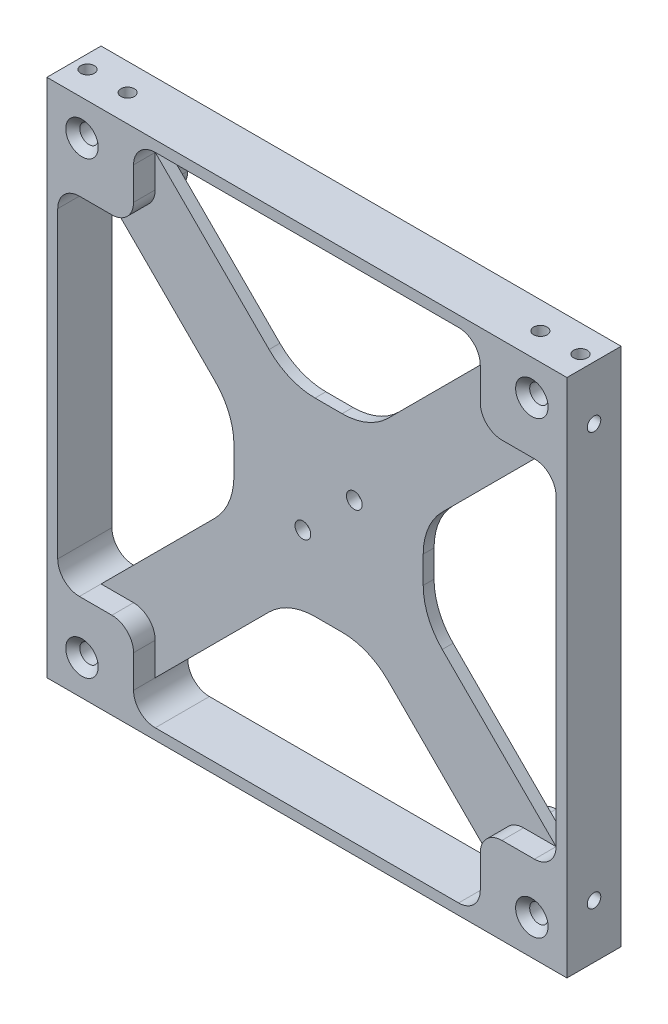
from build123d import *

# Parameters (mm, degrees)
BOTTOMLAYER_DEPTH              = 4
MIDDLELAYER_DEPTH              = 2
FILLUPLAYER_START              = -2
FILLUPLAYER_DEPTH              = 2
TOPLAYER_DEPTH                 = 4
M3_CLEARANCE_HOLE1_D           = 3.4
M3_CLEARANCE_HOLE1_CSINK_D     = 6
M3_CLEARANCE_HOLE1_CSINK_ANGLE = 90
M2_5_CLEARANCE_HOLE1_D         = 2.9
CIRPATTERN1_COUNT              = 4
SKETCH30_R                     = 3.25
CUT_EXTRUDE1_DEPTH             = 3.4
CIRPATTERN2_COUNT              = 4


with BuildPart() as part:
    # Sketch3 → BottomLayer (new body)
    with BuildSketch(Plane.XY):
        with BuildLine():
            Line((0, 48), (48, 48))
            Line((48, 48), (48, 0))
            Line((48, 0), (46, 0))
            Line((46, 0), (46, 28))
            ThreePointArc((46, 28), (44.828427125, 30.828427125), (42, 32))
            Line((42, 32), (36, 32))
            ThreePointArc((36, 32), (33.171572875, 33.171572875), (32, 36))
            Line((32, 36), (32, 42))
            ThreePointArc((32, 42), (30.828427125, 44.828427125), (28, 46))
            Line((28, 46), (0, 46))
            Line((0, 46), (0, 48))
        make_face()
    bottomlayer = extrude(amount=BOTTOMLAYER_DEPTH)

    # Sketch6 → MiddleLayer (add)
    with BuildSketch(Plane.XY.offset(4)):
        with BuildLine():
            Line((0, 17.470562748), (0, 0))
            Line((0, 0), (17.470562748, 0))
            Line((17.470562748, 0), (17.470562748, 2.5))
            ThreePointArc((17.470562748, 2.5), (18.384008358, 7.092201188), (20.985281374, 10.985281374))
            Line((20.985281374, 10.985281374), (48, 38))
            Line((48, 38), (48, 48))
            Line((48, 48), (38, 48))
            Line((38, 48), (10.985281374, 20.985281374))
            ThreePointArc((10.985281374, 20.985281374), (7.092201188, 18.384008358), (2.5, 17.470562748))
            Line((2.5, 17.470562748), (0, 17.470562748))
        make_face()
    middlelayer = extrude(amount=MIDDLELAYER_DEPTH)

    # Sketch10 → FillUpLayer (add)
    with BuildSketch(Plane.XY.offset(6).offset(FILLUPLAYER_START)):
        with BuildLine():
            Line((48, 48), (0, 48))
            Line((0, 48), (0, 46))
            Line((0, 46), (28, 46))
            ThreePointArc((28, 46), (30.828427125, 44.828427125), (32, 42))
            Line((32, 42), (32, 36))
            ThreePointArc((32, 36), (33.171572875, 33.171572875), (36, 32))
            Line((36, 32), (42, 32))
            ThreePointArc((42, 32), (44.828427125, 30.828427125), (46, 28))
            Line((46, 28), (46, 0))
            Line((46, 0), (48, 0))
            Line((48, 0), (48, 48))
        make_face()
    filluplayer = extrude(amount=FILLUPLAYER_DEPTH)

    # Sketch11 → TopLayer (add)
    with BuildSketch(Plane.XY.offset(6)):
        with BuildLine():
            Line((48, 48), (0, 48))
            Line((0, 48), (0, 46))
            Line((0, 46), (28, 46))
            ThreePointArc((28, 46), (30.828427125, 44.828427125), (32, 42))
            Line((32, 42), (32, 36))
            ThreePointArc((32, 36), (33.171572875, 33.171572875), (36, 32))
            Line((36, 32), (42, 32))
            ThreePointArc((42, 32), (44.828427125, 30.828427125), (46, 28))
            Line((46, 28), (46, 0))
            Line((46, 0), (48, 0))
            Line((48, 0), (48, 48))
        make_face()
    toplayer = extrude(amount=TOPLAYER_DEPTH)

    # M3 Clearance Hole1 (through all)
    with Locations(Plane.XY.offset(10)):
        with Locations((41.525, 41.525)):
            m3_clearance_hole1 = CounterSinkHole(M3_CLEARANCE_HOLE1_D / 2, M3_CLEARANCE_HOLE1_CSINK_D / 2, counter_sink_angle=M3_CLEARANCE_HOLE1_CSINK_ANGLE)

    # M2.5 Clearance Hole1 (through all)
    with Locations(Plane.XY.offset(6)):
        with Locations((4.75, 4.75)):
            m2_5_clearance_hole1 = Hole(M2_5_CLEARANCE_HOLE1_D / 2)

    # CirPattern1: BottomLayer, MiddleLayer, FillUpLayer, TopLayer, M3 Clearance Hole1 ×4 about axis
    cirpattern1_axis = Axis((0, 0, -0.5), (0, 0, 1))
    add([bottomlayer.rotate(cirpattern1_axis, i * 360 / CIRPATTERN1_COUNT) for i in range(1, CIRPATTERN1_COUNT)])
    add([middlelayer.rotate(cirpattern1_axis, i * 360 / CIRPATTERN1_COUNT) for i in range(1, CIRPATTERN1_COUNT)])
    add([filluplayer.rotate(cirpattern1_axis, i * 360 / CIRPATTERN1_COUNT) for i in range(1, CIRPATTERN1_COUNT)])
    add([toplayer.rotate(cirpattern1_axis, i * 360 / CIRPATTERN1_COUNT) for i in range(1, CIRPATTERN1_COUNT)])
    add([m3_clearance_hole1.rotate(cirpattern1_axis, i * 360 / CIRPATTERN1_COUNT) for i in range(1, CIRPATTERN1_COUNT)], mode=Mode.SUBTRACT)

    # Sketch21 → Tap Drill M3 Side Plate (revolve, cut)
    with BuildSketch(Plane(origin=(48, 38.1, 5), x_dir=(0, 0, -1), z_dir=(0, 1, 0))):
        Polygon((0, 0), (0, 5.751075774), (1.25, 5), (1.25, 0), align=None)
    tap_drill_m3_side_plate = revolve(axis=Axis((54.35, 38.1, 5), (-1, 0, 0)), mode=Mode.SUBTRACT)

    # Camera Holes: M2.5 Clearance Hole1 across plane
    add(m2_5_clearance_hole1.mirror(Plane(origin=(0, 0, 0), x_dir=(0, 0, 1), z_dir=(-0.7071067811865476, -0.7071067811865476, 0))), mode=Mode.SUBTRACT)

    # Sketch27 → Tap Drill M3 Side Plate 2 (revolve, cut)
    with BuildSketch(Plane(origin=(38.1, 48, 5), x_dir=(0, 0, 1), z_dir=(1, 0, 0))):
        Polygon((0, 0), (0, 5.751075774), (1.25, 5), (1.25, 0), align=None)
    tap_drill_m3_side_plate_2 = revolve(axis=Axis((38.1, 54.35, 5), (0, -1, 0)), mode=Mode.SUBTRACT)

    # Sketch29 → Tap Drill M3 Rail (revolve, cut)
    with BuildSketch(Plane(origin=(45.5, 48, 5), x_dir=(0, 0, 1), z_dir=(1, 0, 0))):
        Polygon((0, 0), (0, 5.751075774), (1.25, 5), (1.25, 0), align=None)
    tap_drill_m3_rail = revolve(axis=Axis((45.5, 54.35, 5), (0, -1, 0)), mode=Mode.SUBTRACT)

    # SidePlate and Rail Holes 1: Tap Drill M3 Side Plate, Tap Drill M3 Side Plate 2, Tap Drill M3 Rail across plane
    add(tap_drill_m3_side_plate.mirror(Plane(origin=(0, 0, 0), x_dir=(0, 0, 1), z_dir=(1, 0, 0))), mode=Mode.SUBTRACT)
    add(tap_drill_m3_side_plate_2.mirror(Plane(origin=(0, 0, 0), x_dir=(0, 0, 1), z_dir=(1, 0, 0))), mode=Mode.SUBTRACT)
    add(tap_drill_m3_rail.mirror(Plane(origin=(0, 0, 0), x_dir=(0, 0, 1), z_dir=(1, 0, 0))), mode=Mode.SUBTRACT)

    # Side Plate and Rail Holes 2 copy 1 sketc → Side Plate and Rail Holes 2 copy 1 (revolve, cut)
    with BuildSketch(Plane(origin=(-48, -38.1, 5), x_dir=(0, 0, -1), z_dir=(0, -1, 0))):
        Polygon((0, 0), (0, 5.751075774), (1.25, 5), (1.25, 0), align=None)
    revolve(axis=Axis((-54.35, -38.1, 5), (1, 0, 0)), mode=Mode.SUBTRACT)

    # Side Plate and Rail Holes 2 copy 2 sketc → Side Plate and Rail Holes 2 copy 2 (revolve, cut)
    with BuildSketch(Plane(origin=(-38.1, -48, 5), x_dir=(0, 0, 1), z_dir=(-1, 0, 0))):
        Polygon((0, 0), (0, 5.751075774), (1.25, 5), (1.25, 0), align=None)
    revolve(axis=Axis((-38.1, -54.35, 5), (0, 1, 0)), mode=Mode.SUBTRACT)

    # Side Plate and Rail Holes 2 copy 3 sketc → Side Plate and Rail Holes 2 copy 3 (revolve, cut)
    with BuildSketch(Plane(origin=(-45.5, -48, 5), x_dir=(0, 0, 1), z_dir=(-1, 0, 0))):
        Polygon((0, 0), (0, 5.751075774), (1.25, 5), (1.25, 0), align=None)
    revolve(axis=Axis((-45.5, -54.35, 5), (0, 1, 0)), mode=Mode.SUBTRACT)

    # Side Plate and Rail Holes 2 copy 4 sketc → Side Plate and Rail Holes 2 copy 4 (revolve, cut)
    with BuildSketch(Plane(origin=(48, -38.1, 5), x_dir=(0, 0, -1), z_dir=(0, -1, 0))):
        Polygon((0, 0), (0, -5.751075774), (1.25, -5), (1.25, 0), align=None)
    revolve(axis=Axis((54.35, -38.1, 5), (1, 0, 0)), mode=Mode.SUBTRACT)

    # Side Plate and Rail Holes 2 copy 5 sketc → Side Plate and Rail Holes 2 copy 5 (revolve, cut)
    with BuildSketch(Plane(origin=(38.1, -48, 5), x_dir=(0, 0, 1), z_dir=(1, 0, 0))):
        Polygon((0, 0), (0, -5.751075774), (1.25, -5), (1.25, 0), align=None)
    revolve(axis=Axis((38.1, -54.35, 5), (0, -1, 0)), mode=Mode.SUBTRACT)

    # Side Plate and Rail Holes 2 copy 6 sketc → Side Plate and Rail Holes 2 copy 6 (revolve, cut)
    with BuildSketch(Plane(origin=(45.5, -48, 5), x_dir=(0, 0, 1), z_dir=(1, 0, 0))):
        Polygon((0, 0), (0, -5.751075774), (1.25, -5), (1.25, 0), align=None)
    revolve(axis=Axis((45.5, -54.35, 5), (0, -1, 0)), mode=Mode.SUBTRACT)

    # Sketch30 → Cut-Extrude1 (cut)
    with BuildSketch(Plane(origin=(0, 0, 0), x_dir=(-1, 0, 0), z_dir=(0, 0, -1))):
        with Locations((-41.525, 41.525)):
            Circle(SKETCH30_R)
    cut_extrude1 = extrude(amount=-CUT_EXTRUDE1_DEPTH, mode=Mode.SUBTRACT)

    # CirPattern2: Cut-Extrude1 ×4 about axis
    cirpattern2_axis = Axis((0, 0, -0.5), (0, 0, 1))
    for i in range(1, CIRPATTERN2_COUNT):
        add(cut_extrude1.rotate(cirpattern2_axis, i * 360 / CIRPATTERN2_COUNT), mode=Mode.SUBTRACT)


solid = part.part
